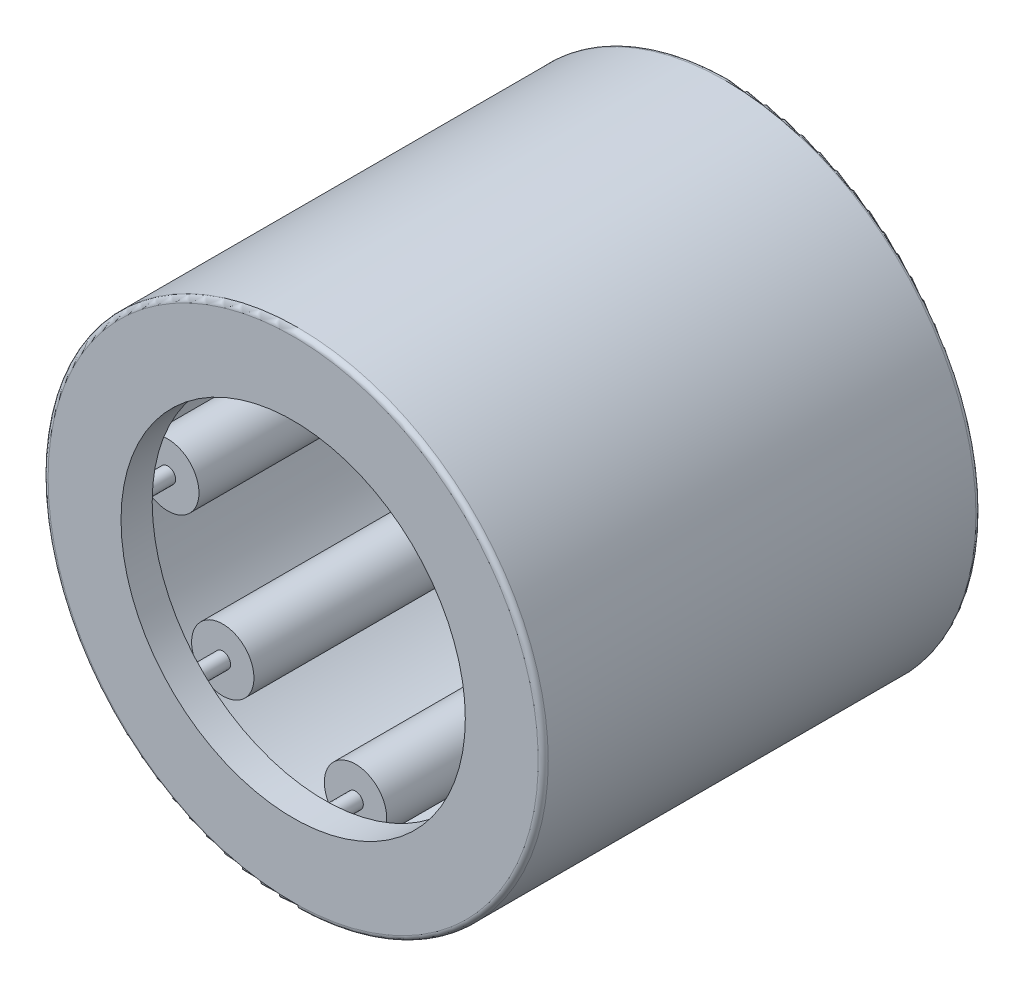
from build123d import *

# Parameters (mm, degrees)
SKETCH2_W         = 7.945966666
SKETCH2_H         = 0.593725
SKETCH3_W         = 9.529233334
SKETCH3_H         = 0.197908334
CIRPATTERN1_COUNT = 8
CIRPATTERN1_ANGLE = 315
FILLET1_R         = 0.127


with BuildPart() as part:
    # Sketch1 → Revolve1 (revolve)
    with BuildSketch(Plane(origin=(0, 0, 0), x_dir=(0, 0, -1), z_dir=(1, 0, 0))):
        Polygon((-5.55625, 6.35), (5.55625, 6.35), (5.55625, 4.370916667), (4.764616667, 4.370916667), (4.764616667, 5.558366667), (-4.764616667, 5.558366667), (-4.764616667, 4.370916667), (-5.55625, 4.370916667), align=None)
    revolve(axis=Axis((0, 0, 5.55625), (0, 0, -1)))

    # Fillet1
    fillet1_edges = [part.edges().sort_by_distance(p)[0] for p in [
        (0, -6.35, -5.55625),
        (0, -6.35, 5.55625),
    ]]
    fillet(fillet1_edges, radius=FILLET1_R)


with BuildPart() as body_2:
    # Sketch2 → Revolve2 (revolve)
    with BuildSketch(Plane(origin=(0, 0, 0), x_dir=(0, 0, -1), z_dir=(1, 0, 0))):
        with Locations((0, 5.261504167)):
            Rectangle(SKETCH2_W, SKETCH2_H)
    revolve(axis=Axis((0, 4.766733333, 3.972983333), (0, 0, -1)))


with BuildPart() as body_3:
    # Sketch3 → Revolve3 (revolve)
    with BuildSketch(Plane(origin=(0, 0, 0), x_dir=(0, 0, -1), z_dir=(1, 0, 0))):
        with Locations((0, 4.8656875)):
            Rectangle(SKETCH3_W, SKETCH3_H)
    revolve(axis=Axis((0, 4.766733333, 4.764616667), (0, 0, -1)))


with BuildPart() as cirpattern1_1:
    # CirPattern1: pattern copy
    add(body_2.part.rotate(Axis((0, 0, -5.55625), (0, 0, 1)), 1 * CIRPATTERN1_ANGLE / (CIRPATTERN1_COUNT - 1)))


with BuildPart() as cirpattern1_2:
    # CirPattern1: pattern copy
    add(body_2.part.rotate(Axis((0, 0, -5.55625), (0, 0, 1)), 2 * CIRPATTERN1_ANGLE / (CIRPATTERN1_COUNT - 1)))


with BuildPart() as cirpattern1_3:
    # CirPattern1: pattern copy
    add(body_2.part.rotate(Axis((0, 0, -5.55625), (0, 0, 1)), 3 * CIRPATTERN1_ANGLE / (CIRPATTERN1_COUNT - 1)))


with BuildPart() as cirpattern1_4:
    # CirPattern1: pattern copy
    add(body_2.part.rotate(Axis((0, 0, -5.55625), (0, 0, 1)), 4 * CIRPATTERN1_ANGLE / (CIRPATTERN1_COUNT - 1)))


with BuildPart() as cirpattern1_5:
    # CirPattern1: pattern copy
    add(body_2.part.rotate(Axis((0, 0, -5.55625), (0, 0, 1)), 5 * CIRPATTERN1_ANGLE / (CIRPATTERN1_COUNT - 1)))


with BuildPart() as cirpattern1_6:
    # CirPattern1: pattern copy
    add(body_2.part.rotate(Axis((0, 0, -5.55625), (0, 0, 1)), 6 * CIRPATTERN1_ANGLE / (CIRPATTERN1_COUNT - 1)))


with BuildPart() as cirpattern1_7:
    # CirPattern1: pattern copy
    add(body_2.part.rotate(Axis((0, 0, -5.55625), (0, 0, 1)), 7 * CIRPATTERN1_ANGLE / (CIRPATTERN1_COUNT - 1)))


with BuildPart() as cirpattern1_8:
    # CirPattern1: pattern copy
    add(body_3.part.rotate(Axis((0, 0, -5.55625), (0, 0, 1)), 1 * CIRPATTERN1_ANGLE / (CIRPATTERN1_COUNT - 1)))


with BuildPart() as cirpattern1_9:
    # CirPattern1: pattern copy
    add(body_3.part.rotate(Axis((0, 0, -5.55625), (0, 0, 1)), 2 * CIRPATTERN1_ANGLE / (CIRPATTERN1_COUNT - 1)))


with BuildPart() as cirpattern1_10:
    # CirPattern1: pattern copy
    add(body_3.part.rotate(Axis((0, 0, -5.55625), (0, 0, 1)), 3 * CIRPATTERN1_ANGLE / (CIRPATTERN1_COUNT - 1)))


with BuildPart() as cirpattern1_11:
    # CirPattern1: pattern copy
    add(body_3.part.rotate(Axis((0, 0, -5.55625), (0, 0, 1)), 4 * CIRPATTERN1_ANGLE / (CIRPATTERN1_COUNT - 1)))


with BuildPart() as cirpattern1_12:
    # CirPattern1: pattern copy
    add(body_3.part.rotate(Axis((0, 0, -5.55625), (0, 0, 1)), 5 * CIRPATTERN1_ANGLE / (CIRPATTERN1_COUNT - 1)))


with BuildPart() as cirpattern1_13:
    # CirPattern1: pattern copy
    add(body_3.part.rotate(Axis((0, 0, -5.55625), (0, 0, 1)), 6 * CIRPATTERN1_ANGLE / (CIRPATTERN1_COUNT - 1)))


with BuildPart() as cirpattern1_14:
    # CirPattern1: pattern copy
    add(body_3.part.rotate(Axis((0, 0, -5.55625), (0, 0, 1)), 7 * CIRPATTERN1_ANGLE / (CIRPATTERN1_COUNT - 1)))


solid = Compound([part.part, body_2.part, body_3.part, cirpattern1_1.part, cirpattern1_2.part, cirpattern1_3.part, cirpattern1_4.part, cirpattern1_5.part, cirpattern1_6.part, cirpattern1_7.part, cirpattern1_8.part, cirpattern1_9.part, cirpattern1_10.part, cirpattern1_11.part, cirpattern1_12.part, cirpattern1_13.part, cirpattern1_14.part])
